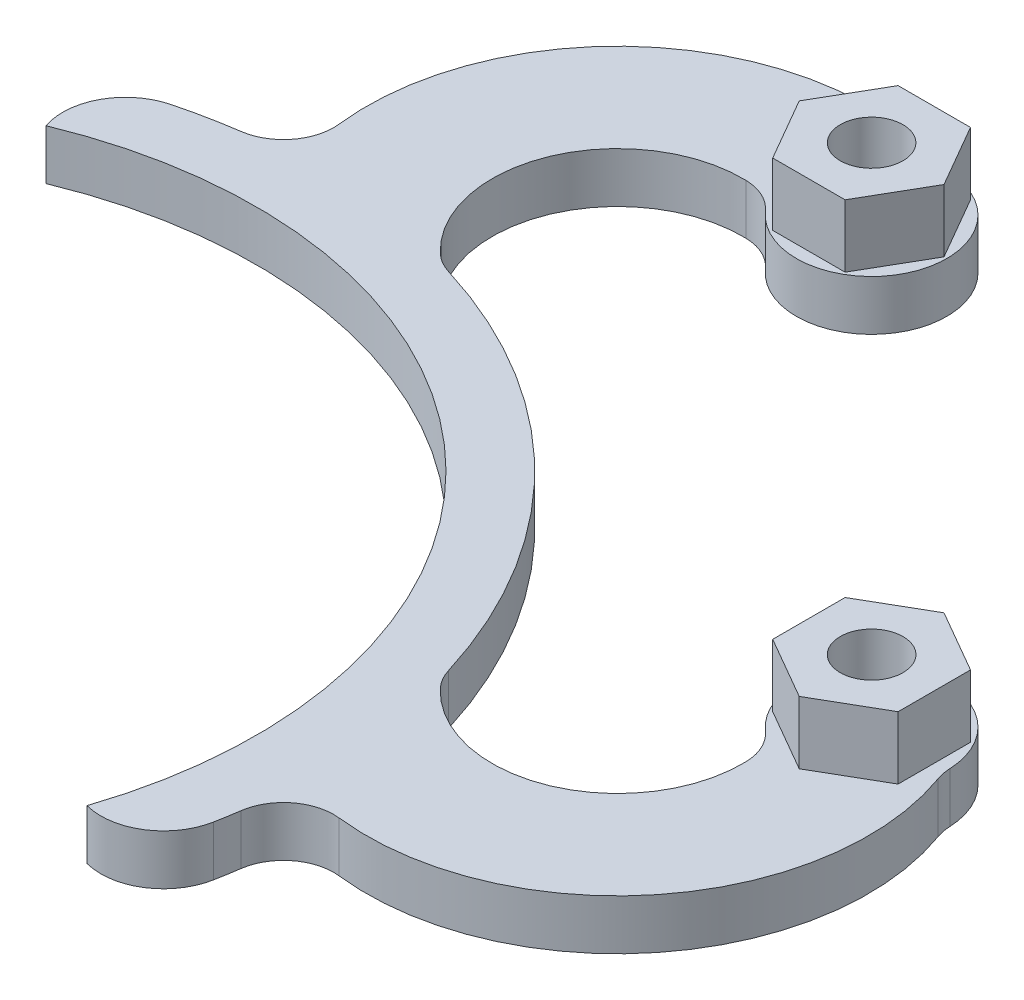
from build123d import *

# Parameters (mm, degrees)
SKETCH1_R           = 2.5
SKETCH1_R_2         = 36.5
BOSS_EXTRUDE1_DEPTH = 4
SKETCH2_R           = 2.5
BOSS_EXTRUDE2_DEPTH = 5
SKETCH3_R           = 64.411178088
CUT_EXTRUDE1_DEPTH  = 10
FILLET1_R           = 5


with BuildPart() as part:
    # Sketch1 → Boss-Extrude1 (new body)
    with BuildSketch(Plane(origin=(0, 0, 0), x_dir=(1, 0, 0), z_dir=(0, 1, 0))):
        with BuildLine():
            ThreePointArc((-35.096538253, 5.994415913), (-29.942413888, -2.588482391), (-39.858946955, -3.964532245))
            ThreePointArc((-39.858946955, -3.964532245), (-41.168529898, -2.983419005), (-42.761405669, -2.608802601))
            ThreePointArc((-42.761405669, -2.608802601), (-52.246827812, -8.771034491), (-49.915694824, -19.839555354))
            ThreePointArc((-49.915694824, -19.839555354), (-49.174030159, -20.398421652), (-48.323482114, -20.771203143))
            ThreePointArc((-48.323482114, -20.771203143), (-31.112698372, -31.112698372), (-20.771203143, -48.323482114))
            ThreePointArc((-20.771203143, -48.323482114), (-20.398421652, -49.174030159), (-19.839555354, -49.915694824))
            ThreePointArc((-19.839555354, -49.915694824), (-8.771034491, -52.246827812), (-2.608802601, -42.761405669))
            ThreePointArc((-2.608802601, -42.761405669), (-2.983419005, -41.168529898), (-3.964532245, -39.858946955))
            ThreePointArc((-3.964532245, -39.858946955), (-2.588482391, -29.942413888), (5.994415913, -35.096538253))
            ThreePointArc((5.994415913, -35.096538253), (6.065284008, -35.692875475), (6.224630915, -36.271882326))
            ThreePointArc((6.224630915, -36.271882326), (3.044943645, -55.463499369), (-14.941352097, -62.87441978))
            ThreePointArc((-14.941352097, -62.87441978), (-17.849646318, -63.67833691), (-19.368850678, -66.285342115))
            ThreePointArc((-19.368850678, -66.285342115), (-89.802561211, -89.802561211), (-66.285342115, -19.368850678))
            ThreePointArc((-66.285342115, -19.368850678), (-63.67833691, -17.849646318), (-62.87441978, -14.941352097))
            ThreePointArc((-62.87441978, -14.941352097), (-55.463499369, 3.044943645), (-36.271882326, 6.224630915))
            ThreePointArc((-36.271882326, 6.224630915), (-35.692875475, 6.065284008), (-35.096538253, 5.994415913))
        make_face()
        with Locations(Location((0, -35.355339059, 0), (0, 0, 270))):
            Circle(SKETCH1_R, mode=Mode.SUBTRACT)
        with Locations(Location((-35.355339059, 0, 0), (0, 0, 270))):
            Circle(SKETCH1_R, mode=Mode.SUBTRACT)
        with Locations(Location((-60.457629791, -60.457629791, 0), (0, 0, 270))):
            Circle(SKETCH1_R_2, mode=Mode.SUBTRACT)
    extrude(amount=BOSS_EXTRUDE1_DEPTH)

    # Sketch2 → Boss-Extrude2 (add)
    # profile 1 of 2: a face of its own
    with BuildSketch(Plane(origin=(0, 4, 0), x_dir=(1, 0, 0), z_dir=(0, 1, 0))):
        Polygon((-32.468587713, -5), (-29.581836367, 0), (-32.468587713, 5), (-38.242090405, 5), (-41.128841751, 0), (-38.242090405, -5), align=None)
        with Locations(Location((-35.355339059, 0, 0), (0, 0, 270))):
            Circle(SKETCH2_R, mode=Mode.SUBTRACT)
    # profile 2 of 2: a face of its own
    with BuildSketch(Plane(origin=(0, 4, 0), x_dir=(1, 0, 0), z_dir=(0, 1, 0))):
        Polygon((-5, -38.242090405), (-5, -32.468587713), (0, -29.581836367), (5, -32.468587713), (5, -38.242090405), (0, -41.128841751), align=None)
        with Locations(Location((0, -35.355339059, 0), (0, 0, 90))):
            Circle(SKETCH2_R, mode=Mode.SUBTRACT)
    extrude(amount=BOSS_EXTRUDE2_DEPTH)

    # Sketch3 → Cut-Extrude1 (cut)
    with BuildSketch(Plane(origin=(0, 4, 0), x_dir=(1, 0, 0), z_dir=(0, 1, 0))):
        with Locations((-87.790328178, -89.76214525)):
            Circle(SKETCH3_R)
    extrude(amount=-CUT_EXTRUDE1_DEPTH, mode=Mode.SUBTRACT)

    # Fillet1
    # the kernel refuses this fillet: 5 mm, written as the material it takes off along each edge
    with BuildSketch(Plane(origin=(-82.88269404, 36.492109743, 25.538201196), x_dir=(0.9156666742355372, 0, -0.40193847998721216), z_dir=(0, -1, 0))) as fillet1_piece_1:
        with BuildLine():
            CenterArc((12.213901494, 4.938319673), FILLET1_R, 185.081491193, 93.927443362)
            ThreePointArc((7.233552845, 4.495457015), (3.691158281, 2.128042099), (0, 0))
            ThreePointArc((0, 0), (6.498421949, -0.511946714), (12.996843897, 0))
        make_face()
    extrude(amount=68.984219486, mode=Mode.SUBTRACT)
    with BuildSketch(Plane(origin=(-24.063187691, 36.492109743, 80.399911111), x_dir=(-0.2104426135040135, 0, -0.9776062123481011), z_dir=(0, -1, 0))) as fillet1_piece_2:
        with BuildLine():
            CenterArc((12.98043651, 2.252700357), FILLET1_R, 112.850896292, 93.927443362)
            ThreePointArc((11.038764851, 6.860293131), (5.249154934, 3.86496439), (0, 0))
            ThreePointArc((0, 0), (4.258327739, 0.140916633), (8.516655478, 0))
        make_face()
    extrude(amount=68.984219486, mode=Mode.SUBTRACT)


solid = part.part
